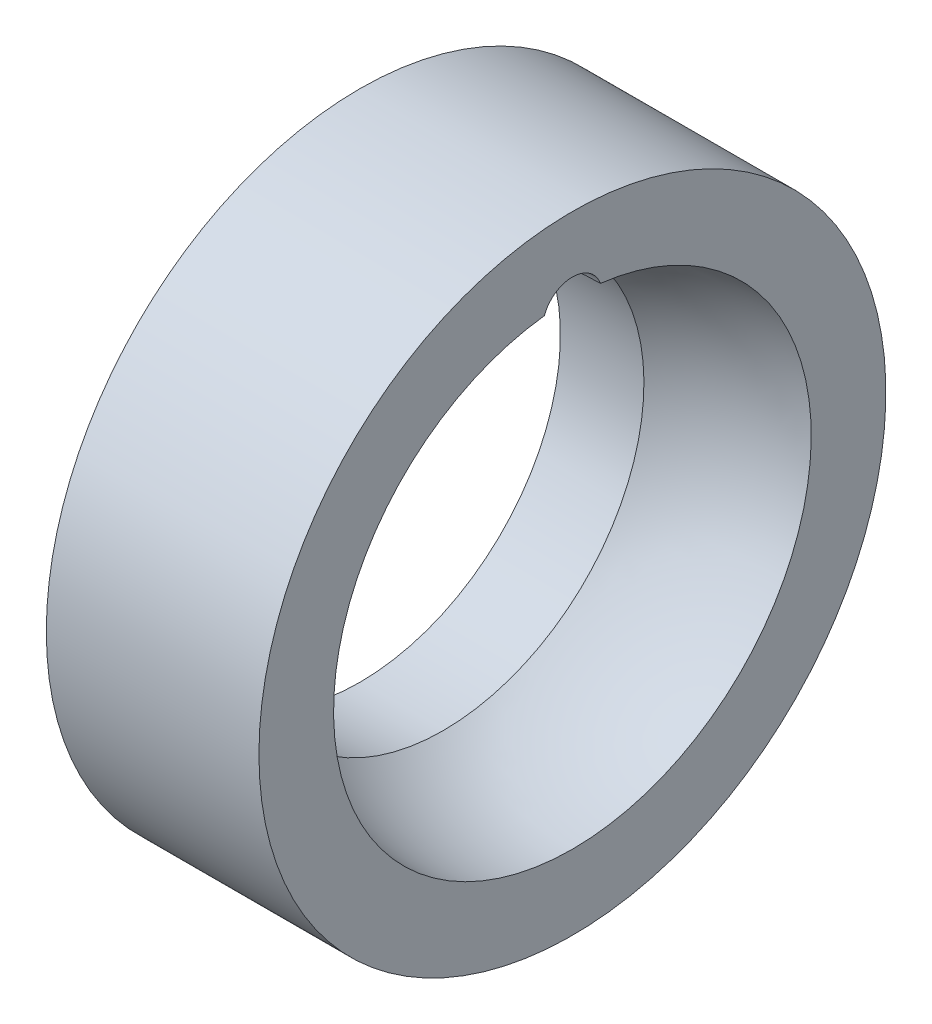
from build123d import *

# Parameters (mm, degrees)
SKETCH2_R               = 5
CUT_EXTRUDE1_DEPTH      = 121.610565007
CUT_EXTRUDE1_DEPTH_BACK = 121.610565007
SKETCH8_W               = 102.655882927
SKETCH8_H               = 176.693518591
SKETCH9_R               = 33.603200741
CUT_EXTRUDE2_DEPTH      = 83.343129825


with BuildPart() as part:
    # Sketch1 → Revolve1 (revolve)
    with BuildSketch(Plane.XY):
        with BuildLine():
            Line((-95.04950495, 12.5), (-28.368359736, 12.5))
            Line((-28.368359736, 12.5), (-28.368359736, 52.5))
            Line((-28.368359736, 52.5), (20.043932092, 52.5))
            Line((20.043932092, 52.5), (20.043932092, 40))
            ThreePointArc((20.043932092, 40), (-8.189799598, 28.256658726), (-19.877866465, 0))
            Line((-19.877866465, 0), (-95.04950495, 0))
            Line((-95.04950495, 0), (-95.04950495, 12.5))
        make_face()
    revolve(axis=Axis((-142.821782178, 0, 0), (1, 0, 0)))

    # Cut-Sweep1: sweep along a path in Sketch3
    with BuildLine(Plane.XY) as cut_sweep1_path:
        ThreePointArc((20.043932092, 38), (1.499272224, 33.167688952), (-12.328884234, 19.899767916))
    # Sketch2 → Cut-Sweep1 (sweep, cut)
    with BuildSketch(Plane(origin=(20.043932092, 0, 0), x_dir=(0, 0, -1), z_dir=(1, 0, 0))):
        with Locations((0, 38)):
            Circle(SKETCH2_R)
    sweep(path=cut_sweep1_path.line, mode=Mode.SUBTRACT)

    # Sketch8 → Cut-Extrude1 (cut, two sides: drawn at the far end of the back side and taken through both)
    with BuildSketch(Plane.XY.offset(-CUT_EXTRUDE1_DEPTH_BACK)):
        with Locations((-66.891466474, -2.050906912)):
            Rectangle(SKETCH8_W, SKETCH8_H)
    extrude(amount=CUT_EXTRUDE1_DEPTH + CUT_EXTRUDE1_DEPTH_BACK, mode=Mode.SUBTRACT)

    # Sketch9 → Cut-Extrude2 (cut, through all)
    with BuildSketch(Plane.ZY.offset(15.56352501)):
        Circle(SKETCH9_R)
    extrude(amount=-CUT_EXTRUDE2_DEPTH, mode=Mode.SUBTRACT)


solid = part.part
